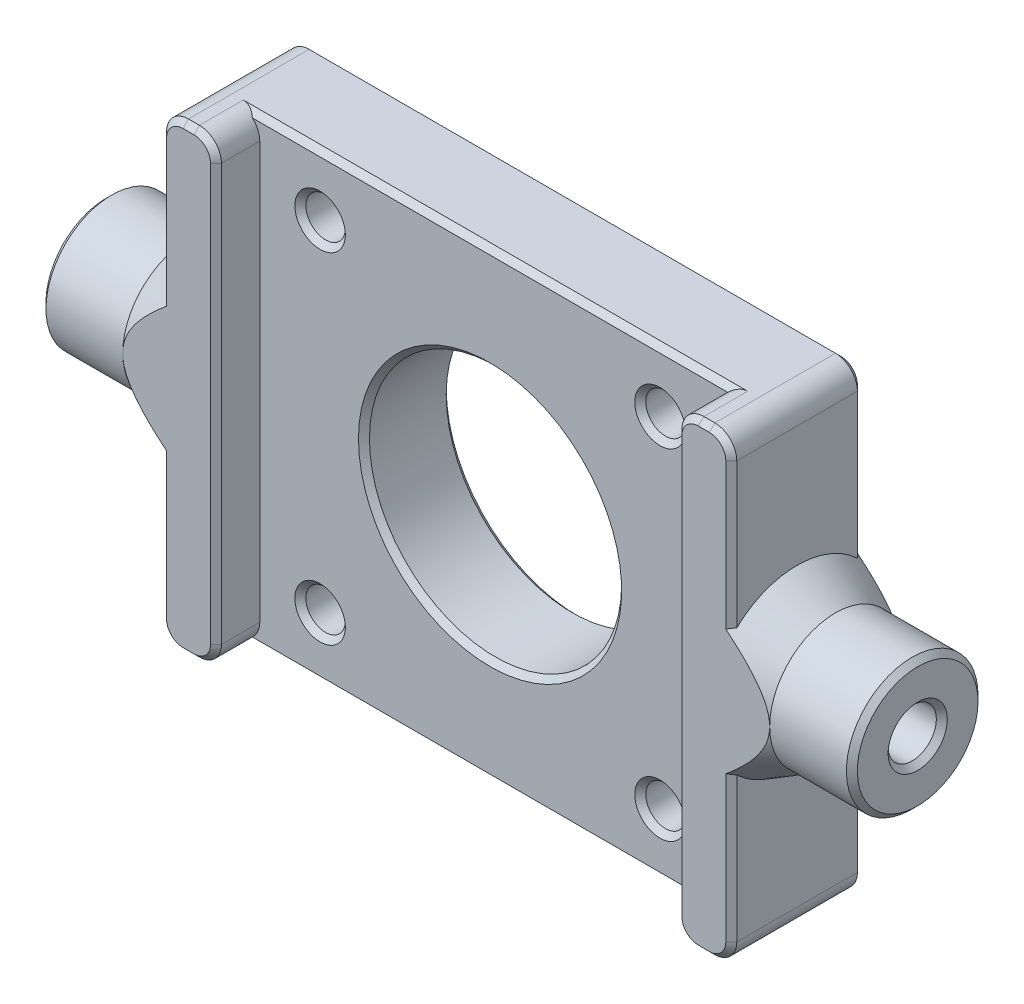
from build123d import *

# Parameters (mm, degrees)
AUFSATZ_LINEAR_AUSTRAGEN1_DEPTH = 8
SKIZZE2_W                       = 5
SKIZZE2_H                       = 42
AUFSATZ_LINEAR_AUSTRAGEN2_DEPTH = 4
SKIZZE3_R                       = 6
AUFSATZ_LINEAR_AUSTRAGEN3_DEPTH = 11
SKIZZE5_R                       = 2.2
SCHNITT_LINEAR_AUSTRAGEN2_DEPTH = 10
SKIZZE4_R                       = 11.5
SKIZZE4_R_2                     = 1.8
SCHNITT_LINEAR_AUSTRAGEN1_DEPTH = 8
FASE1_SIZE                      = 2
FASE1_SIZE_2                    = 3.5
FASE2_SIZE                      = 2
FASE2_SIZE_2                    = 3.5
VERRUNDUNG1_R                   = 2
FASE3_SIZE                      = 0.5


with BuildPart() as part:
    # Skizze1 → Aufsatz-Linear austragen1 (new body)
    with BuildSketch(Plane.XY):
        Polygon((21, 21), (26, 21), (26, -21), (21, -21), (-21, -21), (-26, -21), (-26, 21), (-21, 21), align=None)
    extrude(amount=AUFSATZ_LINEAR_AUSTRAGEN1_DEPTH)

    # Skizze2 → Aufsatz-Linear austragen2 (add)
    with BuildSketch(Plane.XY.offset(8)):
        with Locations((23.5, 0)):
            Rectangle(SKIZZE2_W, SKIZZE2_H)
        with Locations((-23.5, 0)):
            Rectangle(SKIZZE2_W, SKIZZE2_H)
    extrude(amount=AUFSATZ_LINEAR_AUSTRAGEN2_DEPTH)

    # Skizze3 → Aufsatz-Linear austragen3 (add)
    with BuildSketch(Plane(origin=(26, 0, 0), x_dir=(0, 0, -1), z_dir=(1, 0, 0))):
        with Locations((-6, 0)):
            Circle(SKIZZE3_R)
    aufsatz_linear_austragen3 = extrude(amount=AUFSATZ_LINEAR_AUSTRAGEN3_DEPTH)

    # Skizze5 → Schnitt-Linear austragen2 (cut)
    with BuildSketch(Plane(origin=(37, 0, 0), x_dir=(0, 0, -1), z_dir=(1, 0, 0))):
        with Locations(Location((-6, 0, 0), (0, 0, 90))):
            Circle(SKIZZE5_R)
    schnitt_linear_austragen2 = extrude(amount=-SCHNITT_LINEAR_AUSTRAGEN2_DEPTH, mode=Mode.SUBTRACT)

    # Spiegeln1: Aufsatz-Linear austragen3, Schnitt-Linear austragen2 across plane
    add(aufsatz_linear_austragen3.mirror(Plane(origin=(0, 0, 0), x_dir=(0, 0, 1), z_dir=(1, 0, 0))))
    add(schnitt_linear_austragen2.mirror(Plane(origin=(0, 0, 0), x_dir=(0, 0, 1), z_dir=(1, 0, 0))), mode=Mode.SUBTRACT)

    # Skizze4 → Schnitt-Linear austragen1 (cut)
    with BuildSketch(Plane.XY.offset(8)):
        Circle(SKIZZE4_R)
        with Locations((-15.5, 15.5)):
            Circle(SKIZZE4_R_2)
        with Locations((15.5, 15.5)):
            Circle(SKIZZE4_R_2)
        with Locations((15.5, -15.5)):
            Circle(SKIZZE4_R_2)
        with Locations((-15.5, -15.5)):
            Circle(SKIZZE4_R_2)
    extrude(amount=-SCHNITT_LINEAR_AUSTRAGEN1_DEPTH, mode=Mode.SUBTRACT)

    # Fase1
    # the kernel refuses this chamfer: 3.5, 2 mm, written as the material it adds along each edge
    with BuildSketch(Plane(origin=(26, 0, 6), x_dir=(0, 0, -1), z_dir=(0, -1, 0))) as fase1_piece_1_section:
        Polygon((6 + FASE1_SIZE, 0), (6, FASE1_SIZE_2), (6, 0), align=None)
    fase1_piece_1 = revolve(axis=Axis((26, 0, 6), (1, 0, 0)), revolution_arc=180.000000388, mode=Mode.PRIVATE)
    fase1_piece_1 = split(fase1_piece_1, bisect_by=Plane(origin=(27.731298747, 6.967272798, 0), z_dir=(0, 0, 1)), keep=Keep.TOP, mode=Mode.PRIVATE)
    fase1_piece_1 = split(fase1_piece_1, bisect_by=Plane(origin=(27.731298747, 6.967272798, 12), z_dir=(0, 0, -1)), keep=Keep.TOP, mode=Mode.PRIVATE)
    add(fase1_piece_1)
    with BuildSketch(Plane(origin=(26, 0, 6), x_dir=(0, -6.764954696085317e-09, 1.0), z_dir=(0, 1.0, 6.764954696085317e-09))) as fase1_piece_2_section:
        Polygon((6 + FASE1_SIZE, 0), (6, FASE1_SIZE_2), (6, 0), align=None)
    fase1_piece_2 = revolve(axis=Axis((26, 0, 6), (1, 0, 0)), revolution_arc=179.999999612, mode=Mode.PRIVATE)
    fase1_piece_2 = split(fase1_piece_2, bisect_by=Plane(origin=(27.731298743, -6.9672728, 0), z_dir=(0, 0, 1)), keep=Keep.TOP, mode=Mode.PRIVATE)
    fase1_piece_2 = split(fase1_piece_2, bisect_by=Plane(origin=(27.731298743, -6.9672728, 12), z_dir=(0, 0, -1)), keep=Keep.TOP, mode=Mode.PRIVATE)
    add(fase1_piece_2)

    # Fase2
    # the kernel refuses this chamfer: 3.5, 2 mm, written as the material it adds along each edge
    with BuildSketch(Plane(origin=(-26, 0, 6), x_dir=(0, 0, -1), z_dir=(0, -1, 0))) as fase2_piece_1_section:
        Polygon((6 + FASE2_SIZE, 0), (6, -FASE2_SIZE_2), (6, 0), align=None)
    fase2_piece_1 = revolve(axis=Axis((-26, 0, 6), (1, 0, 0)), revolution_arc=180.000000388, mode=Mode.PRIVATE)
    fase2_piece_1 = split(fase2_piece_1, bisect_by=Plane(origin=(-27.731298747, 6.967272798, 0), z_dir=(0, 0, 1)), keep=Keep.TOP, mode=Mode.PRIVATE)
    fase2_piece_1 = split(fase2_piece_1, bisect_by=Plane(origin=(-27.731298747, 6.967272798, 12), z_dir=(0, 0, -1)), keep=Keep.TOP, mode=Mode.PRIVATE)
    add(fase2_piece_1)
    with BuildSketch(Plane(origin=(-26, 0, 6), x_dir=(0, -6.764954696085317e-09, 1.0), z_dir=(0, 1.0, 6.764954696085317e-09))) as fase2_piece_2_section:
        Polygon((6 + FASE2_SIZE, 0), (6, -FASE2_SIZE_2), (6, 0), align=None)
    fase2_piece_2 = revolve(axis=Axis((-26, 0, 6), (1, 0, 0)), revolution_arc=179.999999612, mode=Mode.PRIVATE)
    fase2_piece_2 = split(fase2_piece_2, bisect_by=Plane(origin=(-27.731298743, -6.9672728, 0), z_dir=(0, 0, 1)), keep=Keep.TOP, mode=Mode.PRIVATE)
    fase2_piece_2 = split(fase2_piece_2, bisect_by=Plane(origin=(-27.731298743, -6.9672728, 12), z_dir=(0, 0, -1)), keep=Keep.TOP, mode=Mode.PRIVATE)
    add(fase2_piece_2)

    # Verrundung1
    verrundung1_edges = [part.edges().sort_by_distance(p)[0] for p in [
        (26, 21, 6),
        (26, -21, 6),
        (-26, -21, 6),
        (-26, 21, 6),
        (21, -21, 10),
        (21, 21, 10),
        (-21, 21, 10),
        (-21, -21, 10),
    ]]
    fillet(verrundung1_edges, radius=VERRUNDUNG1_R)

    # Fase3
    fase3_edges = [part.edges().sort_by_distance(p)[0] for p in [
        (-26, -12.145751311, 0),
        (-26, 12.145751311, 12),
        (-21, 0, 12),
        (0, -21, 0),
        (23.5, -21, 12),
        (-23.5, -21, 12),
        (-23.5, 21, 12),
        (-26, -12.145751311, 12),
        (-25.414213562, 20.414213562, 12),
        (-25.414213562, -20.414213562, 12),
        (-21.585786438, 20.414213562, 12),
        (-21.585786438, -20.414213562, 12),
        (21, 0, 12),
        (26, 12.145751311, 12),
        (23.5, 21, 12),
        (25.414213562, 20.414213562, 12),
        (25.414213562, -20.414213562, 12),
        (21.585786438, 20.414213562, 12),
        (21.585786438, -20.414213562, 12),
        (0, 21, 0),
        (-26, 12.145751311, 0),
        (26, -12.145751311, 0),
        (25.414213562, 20.414213562, 0),
        (-25.414213562, 20.414213562, 0),
        (25.414213562, -20.414213562, 0),
        (-25.414213562, -20.414213562, 0),
        (0, 21, 8),
        (0, -21, 8),
        (37, 0, 12),
        (37, -2.2, 6),
        (-37, 0, 12),
        (-37, -2.2, 6),
        (-17.3, -15.5, 0),
        (-17.3, -15.5, 8),
        (13.7, -15.5, 0),
        (13.7, -15.5, 8),
        (13.7, 15.5, 0),
        (13.7, 15.5, 8),
        (-17.3, 15.5, 0),
        (-17.3, 15.5, 8),
        (-11.5, 0, 0),
        (-11.5, 0, 8),
        (26, -12.145751311, 12),
        (26, 12.145751311, 0),
    ]]
    chamfer(fase3_edges, length=FASE3_SIZE)


solid = part.part
